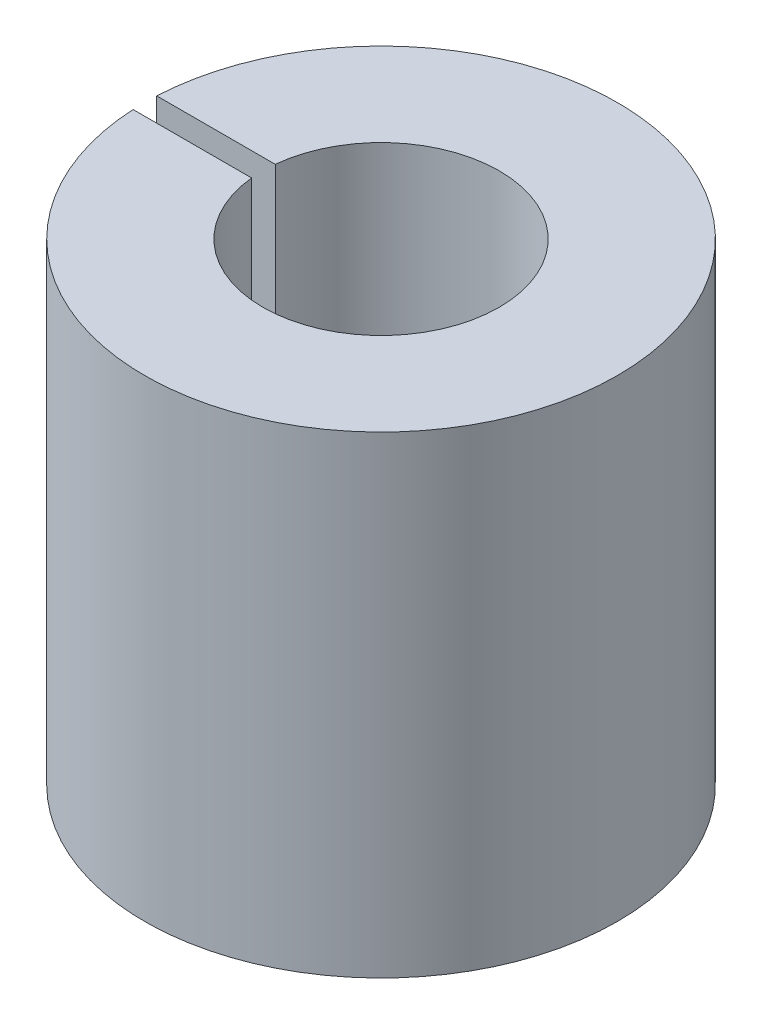
from build123d import *

# Parameters (mm, degrees)
ESQUISSE2_R              = 5
BOSS_EXTRU_1_DEPTH       = 10
ESQUISSE2_5_R            = 2.5
ENL_V_MAT_EXTRU_2_DEPTH  = 80
ESQUISSE3_W              = 4.555471297
ESQUISSE3_H              = 0.5
ENL_V_MAT_EXTRU_10_DEPTH = 80


with BuildPart() as part:
    # Esquisse2 → Boss.-Extru.1 (new body)
    with BuildSketch(Plane(origin=(0, 0, 0), x_dir=(1, 0, 0), z_dir=(0, 1, 0))):
        Circle(ESQUISSE2_R)
    extrude(amount=BOSS_EXTRU_1_DEPTH)

    # Esquisse2<5> → Enlèv. mat.-Extru.2 (cut)
    with BuildSketch(Plane(origin=(0, 0, 0), x_dir=(1, 0, 0), z_dir=(0, 1, 0))):
        Circle(ESQUISSE2_5_R)
    extrude(amount=ENL_V_MAT_EXTRU_2_DEPTH, mode=Mode.SUBTRACT)

    # Esquisse3 → Enlèv. mat.-Extru.10 (cut)
    with BuildSketch(Plane(origin=(0, 10, 0), x_dir=(1, 0, 0), z_dir=(0, 1, 0))):
        with Locations((-3.647973786, 0)):
            Rectangle(ESQUISSE3_W, ESQUISSE3_H)
    extrude(amount=-ENL_V_MAT_EXTRU_10_DEPTH, mode=Mode.SUBTRACT)


solid = part.part
